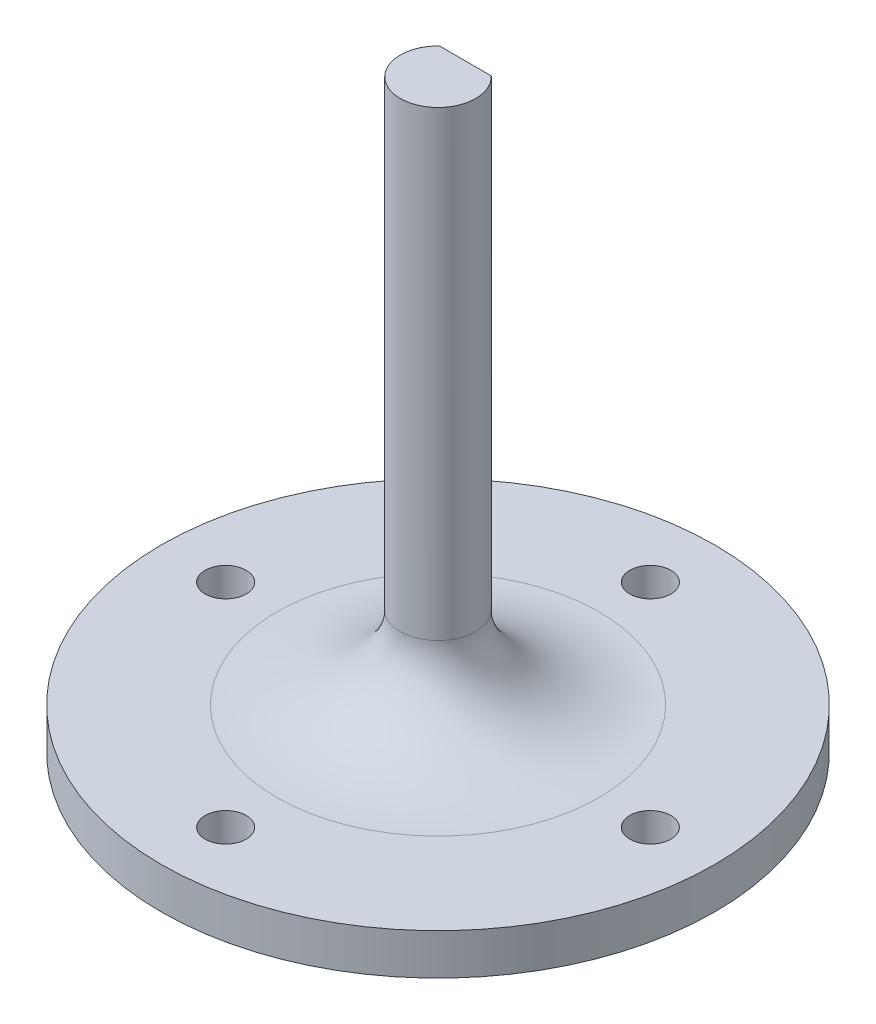
from build123d import *

# Parameters (mm, degrees)
SKETCH2_R           = 20.203446649
SKETCH2_R_2         = 1.5
SKETCH2_R_3         = 2.75
BOSS_EXTRUDE1_DEPTH = 3
BOSS_EXTRUDE2_DEPTH = 39.7
BOSS_EXTRUDE3_DEPTH = 6
FILLET1_SIZE        = 9
FILLET1_SIZE_2      = 6


with BuildPart() as part:
    # Sketch2 → Boss-Extrude1 (new body)
    # profile 1 of 5: a face of its own
    with BuildSketch(Plane(origin=(0, 0, 0), x_dir=(1, 0, 0), z_dir=(0, 1, 0))):
        with Locations(Location((0, 0, 0), (0, 0, 270))):
            Circle(SKETCH2_R)
        with Locations(Location((0, 15.5, 0), (0, 0, 270))):
            Circle(SKETCH2_R_2, mode=Mode.SUBTRACT)
        with Locations(Location((-15.5, 0, 0), (0, 0, 270))):
            Circle(SKETCH2_R_2, mode=Mode.SUBTRACT)
        with Locations(Location((0, -15.5, 0), (0, 0, 270))):
            Circle(SKETCH2_R_2, mode=Mode.SUBTRACT)
        with Locations(Location((15.5, 0, 0), (0, 0, 270))):
            Circle(SKETCH2_R_2, mode=Mode.SUBTRACT)
        Circle(SKETCH2_R_3, mode=Mode.SUBTRACT)
    # profile 2 of 5: a face of its own
    with BuildSketch(Plane(origin=(0, 0, 0), x_dir=(1, 0, 0), z_dir=(0, 1, 0))):
        with BuildLine():
            ThreePointArc((1.887458609, 2), (0, 2.75), (-1.887458609, 2))
            Line((-1.887458609, 2), (1.887458609, 2))
        make_face()
    # profile 3 of 5: a face of its own
    with BuildSketch(Plane(origin=(0, 0, 0), x_dir=(1, 0, 0), z_dir=(0, 1, 0))):
        with BuildLine():
            Line((1.887458609, 2), (-1.887458609, 2))
            ThreePointArc((-1.887458609, 2), (-1.089033706, -2.525174368), (2.75, 0))
            ThreePointArc((2.75, 0), (2.525174368, 1.089033706), (1.887458609, 2))
        make_face()
    # profile 4 of 5: a face of its own
    with BuildSketch(Plane(origin=(0, 0, 0), x_dir=(1, 0, 0), z_dir=(0, 1, 0))):
        with BuildLine():
            ThreePointArc((1.887458609, 2), (0, 2.75), (-1.887458609, 2))
            Line((-1.887458609, 2), (1.887458609, 2))
        make_face()
    # profile 5 of 5: a face of its own
    with BuildSketch(Plane(origin=(0, 0, 0), x_dir=(1, 0, 0), z_dir=(0, 1, 0))):
        with BuildLine():
            Line((1.887458609, 2), (-1.887458609, 2))
            ThreePointArc((-1.887458609, 2), (-1.089033706, -2.525174368), (2.75, 0))
            ThreePointArc((2.75, 0), (2.525174368, 1.089033706), (1.887458609, 2))
        make_face()
    extrude(amount=-BOSS_EXTRUDE1_DEPTH)

    # Sketch2<3> → Boss-Extrude2 (add)
    with BuildSketch(Plane(origin=(0, 0, 0), x_dir=(1, 0, 0), z_dir=(0, 1, 0))):
        with BuildLine():
            Line((1.887458609, 2), (-1.887458609, 2))
            ThreePointArc((-1.887458609, 2), (-1.089033706, -2.525174368), (2.75, 0))
            ThreePointArc((2.75, 0), (2.525174368, 1.089033706), (1.887458609, 2))
        make_face()
    extrude(amount=BOSS_EXTRUDE2_DEPTH)

    # Sketch2<4> → Boss-Extrude3 (add)
    with BuildSketch(Plane(origin=(0, 0, 0), x_dir=(1, 0, 0), z_dir=(0, 1, 0))):
        with BuildLine():
            ThreePointArc((1.887458609, 2), (0, 2.75), (-1.887458609, 2))
            Line((-1.887458609, 2), (1.887458609, 2))
        make_face()
        with BuildLine():
            Line((1.887458609, 2), (-1.887458609, 2))
            ThreePointArc((-1.887458609, 2), (-1.089033706, -2.525174368), (2.75, 0))
            ThreePointArc((2.75, 0), (2.525174368, 1.089033706), (1.887458609, 2))
        make_face()
    extrude(amount=BOSS_EXTRUDE3_DEPTH)

    # Fillet1
    # an asymmetric fillet: 9, 6 mm, written as the material it adds along each edge
    with BuildSketch(Plane(origin=(0, 0, 0), x_dir=(0.6863485850246134, 0, -0.7272727272727275), z_dir=(-0.7272727272727275, 0, -0.6863485850246134))) as fillet1_piece_1_section:
        with BuildLine():
            Bezier((2.75 + FILLET1_SIZE, 0), (2.75, 0), (2.75, -FILLET1_SIZE_2), weights=[1, 0.707106781, 1])
            Line((2.75, -FILLET1_SIZE_2), (2.75, 0))
            Line((2.75, 0), (2.75 + FILLET1_SIZE, 0))
        make_face()
    fillet1_piece_1 = revolve(axis=Axis((0, 0, 0), (0, -1, 0)), mode=Mode.PRIVATE)
    fillet1_piece_1 = split(fillet1_piece_1, bisect_by=Plane(origin=(2.77e-07, 0.848868766, -2), z_dir=(0, 0, -1)), keep=Keep.TOP, mode=Mode.PRIVATE)
    add(fillet1_piece_1)
    with BuildSketch(Plane(origin=(0, 0, 0), x_dir=(0.6863485850246134, 0, -0.7272727272727275), z_dir=(-0.7272727272727275, 0, -0.6863485850246134))) as fillet1_piece_2_section:
        with BuildLine():
            Bezier((2.75 + FILLET1_SIZE, 0), (2.75, 0), (2.75, -FILLET1_SIZE_2), weights=[1, 0.707106781, 1])
            Line((2.75, -FILLET1_SIZE_2), (2.75, 0))
            Line((2.75, 0), (2.75 + FILLET1_SIZE, 0))
        make_face()
    fillet1_piece_2 = revolve(axis=Axis((0, 0, 0), (0, -1, 0)), mode=Mode.PRIVATE)
    fillet1_piece_2 = split(fillet1_piece_2, bisect_by=Plane(origin=(-3.3e-08, 1.056267752, -2), z_dir=(0, 0, 1)), keep=Keep.TOP, mode=Mode.PRIVATE)
    add(fillet1_piece_2)


solid = part.part
